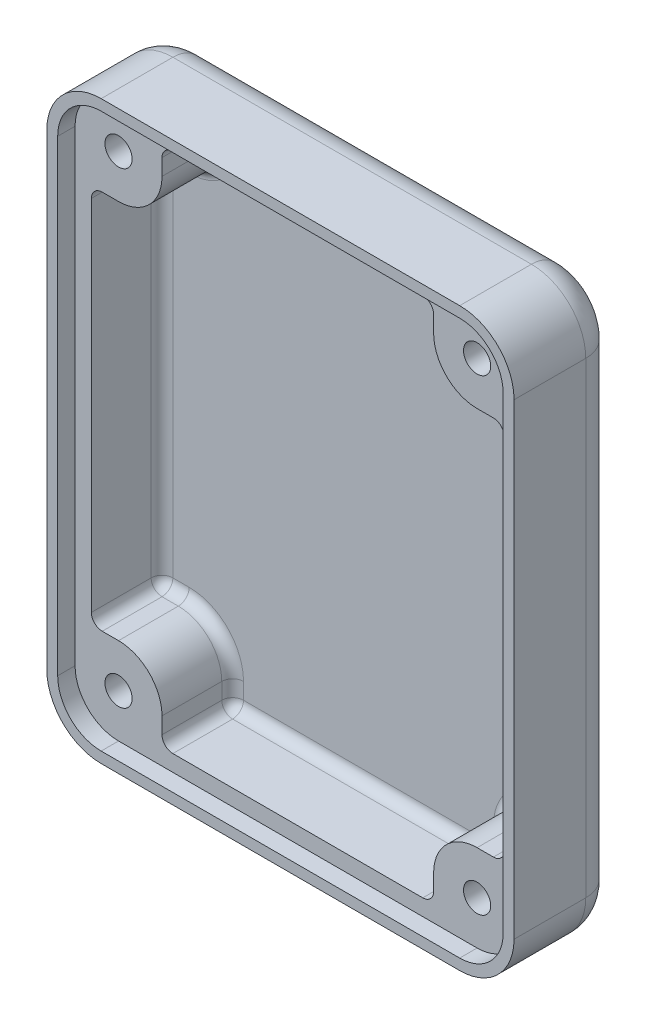
from build123d import *

# Parameters (mm, degrees)
BOSS_EXTRUDE1_DEPTH = 9.6
CUT_EXTRUDE1_START  = 9.6
CUT_EXTRUDE1_DEPTH  = 1.6
CUT_EXTRUDE2_START  = 9.6
CUT_EXTRUDE2_DEPTH  = 8.1
CUT_EXTRUDE3_START  = 9.6
SKETCH5_R           = 1.25
CUT_EXTRUDE3_DEPTH  = 8.1
FILLET1_R           = 3
FILLET2_R           = 1


with BuildPart() as part:
    # Sketch2 → Boss-Extrude1 (new body)
    with BuildSketch(Plane.XY):
        with BuildLine():
            Line((-16.5, 26.5), (16.5, 26.5))
            ThreePointArc((16.5, 26.5), (20.035533906, 25.035533906), (21.5, 21.5))
            Line((21.5, 21.5), (21.5, -21.5))
            ThreePointArc((21.5, -21.5), (20.035533906, -25.035533906), (16.5, -26.5))
            Line((16.5, -26.5), (-16.5, -26.5))
            ThreePointArc((-16.5, -26.5), (-20.035533906, -25.035533906), (-21.5, -21.5))
            Line((-21.5, -21.5), (-21.5, 21.5))
            ThreePointArc((-21.5, 21.5), (-20.035533906, 25.035533906), (-16.5, 26.5))
        make_face()
    extrude(amount=BOSS_EXTRUDE1_DEPTH)

    # Sketch3 → Cut-Extrude1 (cut)
    with BuildSketch(Plane.XY.offset(CUT_EXTRUDE1_START)):
        with BuildLine():
            Line((-16.5, -25.5), (16.5, -25.5))
            ThreePointArc((16.5, -25.5), (19.328427125, -24.328427125), (20.5, -21.5))
            Line((20.5, -21.5), (20.5, 21.5))
            ThreePointArc((20.5, 21.5), (19.328427125, 24.328427125), (16.5, 25.5))
            Line((16.5, 25.5), (-16.5, 25.5))
            ThreePointArc((-16.5, 25.5), (-19.328427125, 24.328427125), (-20.5, 21.5))
            Line((-20.5, 21.5), (-20.5, -21.5))
            ThreePointArc((-20.5, -21.5), (-19.328427125, -24.328427125), (-16.5, -25.5))
        make_face()
    extrude(amount=-CUT_EXTRUDE1_DEPTH, mode=Mode.SUBTRACT)

    # Sketch4 → Cut-Extrude2 (cut)
    with BuildSketch(Plane.XY.offset(CUT_EXTRUDE2_START)):
        with BuildLine():
            Line((-12.5, -21.5), (-12.5, -24))
            Line((-12.5, -24), (12.5, -24))
            Line((12.5, -24), (12.5, -21.5))
            ThreePointArc((12.5, -21.5), (13.671572875, -18.671572875), (16.5, -17.5))
            Line((16.5, -17.5), (19, -17.5))
            Line((19, -17.5), (19, 17.5))
            Line((19, 17.5), (16.5, 17.5))
            ThreePointArc((16.5, 17.5), (13.671572875, 18.671572875), (12.5, 21.5))
            Line((12.5, 21.5), (12.5, 24))
            Line((12.5, 24), (-12.5, 24))
            Line((-12.5, 24), (-12.5, 21.5))
            ThreePointArc((-12.5, 21.5), (-13.671572875, 18.671572875), (-16.5, 17.5))
            Line((-16.5, 17.5), (-19, 17.5))
            Line((-19, 17.5), (-19, -17.5))
            Line((-19, -17.5), (-16.5, -17.5))
            ThreePointArc((-16.5, -17.5), (-13.671572875, -18.671572875), (-12.5, -21.5))
        make_face()
    extrude(amount=-CUT_EXTRUDE2_DEPTH, mode=Mode.SUBTRACT)

    # Sketch5 → Cut-Extrude3 (cut)
    with BuildSketch(Plane.XY.offset(CUT_EXTRUDE3_START)):
        with Locations((-16.5, 21.5)):
            Circle(SKETCH5_R)
        with Locations((16.5, 21.5)):
            Circle(SKETCH5_R)
        with Locations((-16.5, -21.5)):
            Circle(SKETCH5_R)
        with Locations((16.5, -21.5)):
            Circle(SKETCH5_R)
    extrude(amount=-CUT_EXTRUDE3_DEPTH, mode=Mode.SUBTRACT)

    # Fillet1
    fillet1_edges = [part.edges().sort_by_distance(p)[0] for p in [
        (-20.035533906, -25.035533906, 0),
        (-21.5, 0, 0),
        (-20.035533906, 25.035533906, 0),
        (0, 26.5, 0),
        (20.035533906, 25.035533906, 0),
        (21.5, 0, 0),
        (20.035533906, -25.035533906, 0),
        (0, -26.5, 0),
    ]]
    fillet(fillet1_edges, radius=FILLET1_R)

    # Fillet2
    fillet2_edges = [part.edges().sort_by_distance(p)[0] for p in [
        (-17.75, -17.5, 1.5),
        (-12.5, -22.75, 1.5),
        (12.5, -22.75, 1.5),
        (17.75, -17.5, 1.5),
        (17.75, 17.5, 1.5),
        (12.5, 22.75, 1.5),
        (-12.5, 22.75, 1.5),
        (-17.75, 17.5, 1.5),
        (-12.5, 24, 4.75),
        (-19, 17.5, 4.75),
        (-19, -17.5, 4.75),
        (-12.5, -24, 4.75),
        (-13.671572875, -18.671572875, 1.5),
        (0, -24, 1.5),
        (12.5, -24, 4.75),
        (13.671572875, -18.671572875, 1.5),
        (19, -17.5, 4.75),
        (19, 0, 1.5),
        (19, 17.5, 4.75),
        (13.671572875, 18.671572875, 1.5),
        (12.5, 24, 4.75),
        (0, 24, 1.5),
        (-13.671572875, 18.671572875, 1.5),
        (-19, 0, 1.5),
    ]]
    fillet(fillet2_edges, radius=FILLET2_R)


solid = part.part
